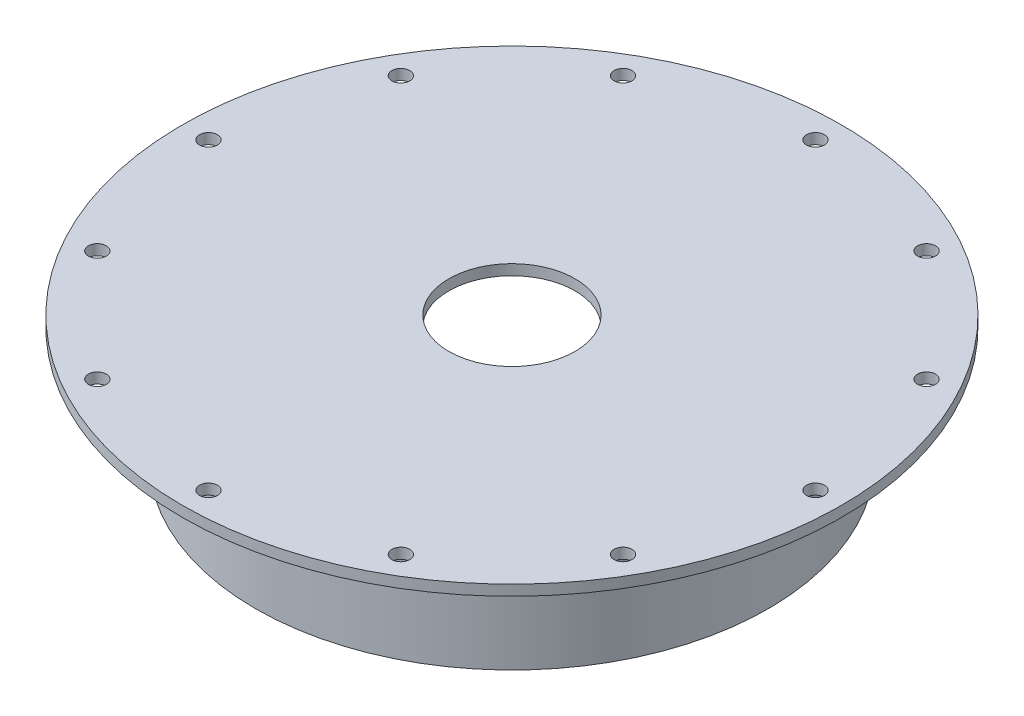
from build123d import *

# Parameters (mm, degrees)
F_36_0_1065_DIAMETER_HOLE1_D = 2.7051
CIRPATTERN1_COUNT            = 12


with BuildPart() as part:
    # Sketch1 → Revolve1 (revolve)
    with BuildSketch(Plane.XY):
        with BuildLine():
            Line((-49.784, 0), (-38.734999999, 0))
            Line((-38.734999999, 0), (-38.734999999, -17.4625))
            Line((-38.734999999, -17.4625), (-35.559999999, -17.4625))
            Line((-35.559999999, -17.4625), (-35.559999999, -3.175))
            ThreePointArc((-35.559999999, -3.175), (-34.63006403, -0.92993597), (-32.384999999, 0))
            Line((-32.384999999, 0), (-9.525, 0))
            Line((-9.525, 0), (-9.525, 1.5875))
            Line((-9.525, 1.5875), (-49.784, 1.5875))
            Line((-49.784, 1.5875), (-49.784, 0))
        make_face()
    revolve(axis=Axis((0, 55, 0), (0, -1, 0)))

    # #36 (0.1065) Diameter Hole1 (through all)
    with Locations(Plane(origin=(0, 1.5875, 0), x_dir=(1, 0, 0), z_dir=(0, 1, 0))):
        with Locations((-45.847, 0)):
            f_36_0_1065_diameter_hole1 = Hole(F_36_0_1065_DIAMETER_HOLE1_D / 2)

    # CirPattern1: #36 (0.1065) Diameter Hole1 ×12 about axis
    cirpattern1_axis = Axis((0, 55, 0), (0, -1, 0))
    for i in range(1, CIRPATTERN1_COUNT):
        add(f_36_0_1065_diameter_hole1.rotate(cirpattern1_axis, i * 360 / CIRPATTERN1_COUNT), mode=Mode.SUBTRACT)


solid = part.part
